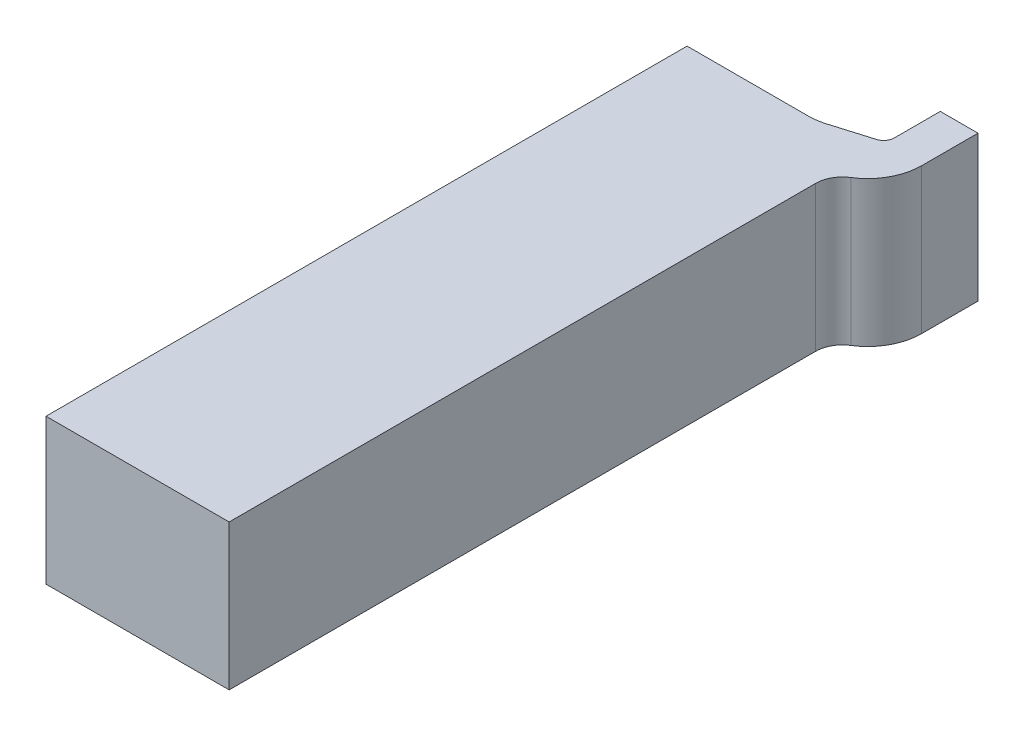
from build123d import *

# Parameters (mm, degrees)
EXTRUDE_367_DEPTH      = 13.5
EXTRUDE_367_DEPTH_BACK = 13.5
SKETCH_1_W             = 34
SKETCH_1_H             = 119
SKETCH_2_W             = 20
SKETCH_2_H             = 27
EXTRUDE_574_DEPTH      = 7
CHAMFER_1_SIZE         = 10
CHAMFER_1_SIZE2        = 3
FILLET_2_R             = 10
FILLET_3_R             = 5
FILLET_4_R             = 2


with BuildPart() as part:
    # Эскиз1 → Extrude 367 (new, two sides: drawn at the far end of the back side and taken through both)
    with BuildSketch(Plane(origin=(0, 0, 0), x_dir=(1, 0, 0), z_dir=(0, 1, 0)).offset(-EXTRUDE_367_DEPTH_BACK)):
        Rectangle(SKETCH_1_W, SKETCH_1_H)
    extrude(amount=EXTRUDE_367_DEPTH + EXTRUDE_367_DEPTH_BACK)

    # Эскиз2 → Extrude 574 (add)
    with BuildSketch(Plane(origin=(17, 0, 0), x_dir=(0, 0, -1), z_dir=(1, 0, 0))):
        with Locations((62.5, 0)):
            Rectangle(SKETCH_2_W, SKETCH_2_H)
    extrude(amount=EXTRUDE_574_DEPTH)

    # Фаска1
    chamfer_1_edges = [part.edges().sort_by_distance(p)[0] for p in [
        (17, 0, -59.5),
    ]]
    chamfer_1_side = [part.faces().sort_by_distance(p)[0] for p in [
        (0, 0, -59.5),
    ]]
    chamfer(chamfer_1_edges, length=CHAMFER_1_SIZE, length2=CHAMFER_1_SIZE2, reference=chamfer_1_side[0])

    # Скругление2
    # the kernel refuses this fillet: 10 mm, written as the material it adds along each edge
    with BuildSketch(Plane(origin=(7, 13.5, -59.5), x_dir=(-1, 0, 0), z_dir=(0, -1, 0))) as fillet_2_piece_1:
        with BuildLine():
            CenterArc((FILLET_2_R * 0.146768836304, FILLET_2_R), FILLET_2_R, 253.300755766, 16.699244234)
            Line((-FILLET_2_R * 0.140579049263, FILLET_2_R * 0.0421737147788), (0, 0))
            Line((0, 0), (FILLET_2_R * 0.146768836304, 0))
        make_face()
    extrude(amount=27)
    # the kernel refuses this fillet: 10 mm, written as the material it takes off along each edge
    with BuildSketch(Plane(origin=(24, -37.348480035, -52.5), x_dir=(0, 0, -1), z_dir=(0, 1, 0))) as fillet_2_2_piece_1:
        with BuildLine():
            CenterArc((9.539392014, 10), FILLET_2_R, 197.457603124, 72.542396876)
            Line((0, 7), (0, 0))
            Line((0, 0), (9.539392014, 0))
        make_face()
    extrude(amount=74.696960071, mode=Mode.SUBTRACT)

    # Скругление3
    fillet_3_edges = [part.edges().sort_by_distance(p)[0] for p in [
        (17, 0, -52.5),
    ]]
    fillet(fillet_3_edges, radius=FILLET_3_R)

    # Скругление4
    fillet_4_edges = [part.edges().sort_by_distance(p)[0] for p in [
        (17, 0, -62.5),
    ]]
    fillet(fillet_4_edges, radius=FILLET_4_R)


solid = part.part
